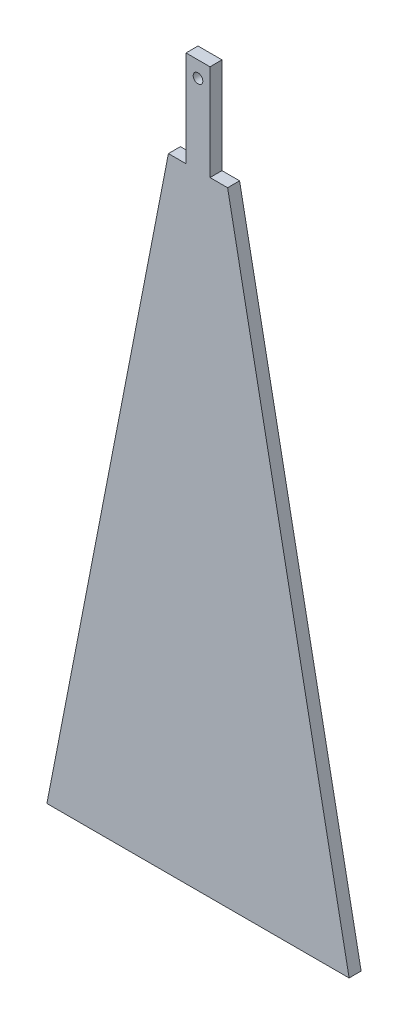
from build123d import *

# Parameters (mm, degrees)
BASE_FLANGE1_DEPTH = 2.5
SKETCH8_R          = 1
CUT_EXTRUDE1_DEPTH = 10


# Sheet-metal steps are written as plain solids
with BuildPart() as part:
    # Sketch1 → Base-Flange1 (new body)
    with BuildSketch(Plane.XY):
        Polygon((-31.5, 0), (31.5, 0), (6.169112777, 130), (2.5, 130), (2.5, 150), (-2.5, 150), (-2.5, 130), (-6.169112777, 130), align=None)
    extrude(amount=-BASE_FLANGE1_DEPTH)

    # Sketch8 → Cut-Extrude1 (cut)
    with BuildSketch(Plane.XY):
        with Locations((0, 146.661825485)):
            Circle(SKETCH8_R)
    extrude(amount=-CUT_EXTRUDE1_DEPTH, mode=Mode.SUBTRACT)


solid = part.part
